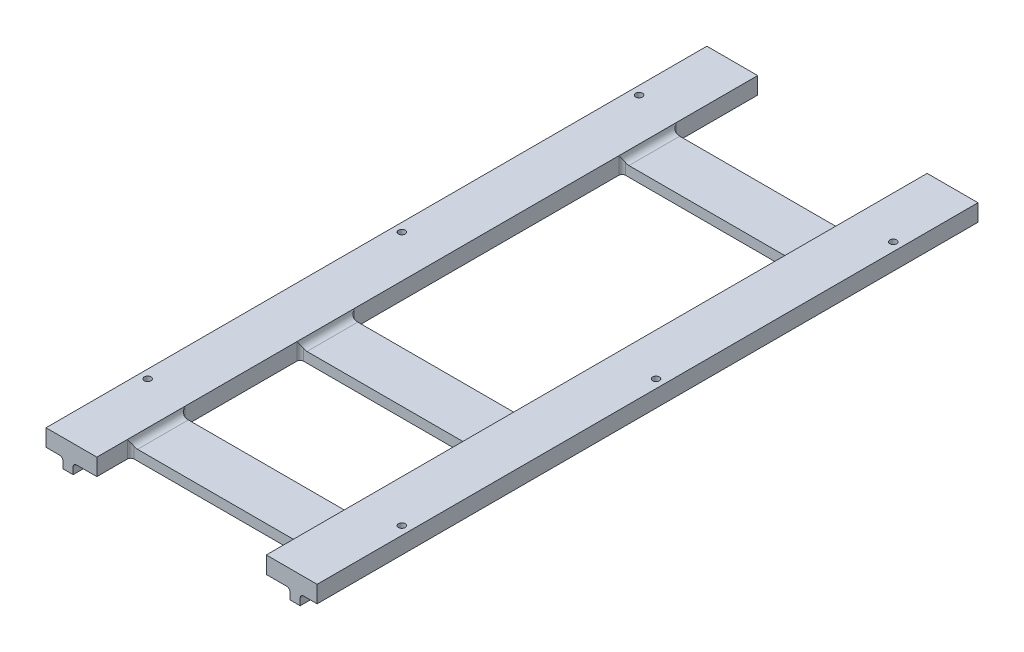
from build123d import *

# Parameters (mm, degrees)
BOSS_EXTRUDE1_DEPTH     = 190
SKETCH2_W               = 50
SKETCH2_H               = 20
CUT_EXTRUDE1_DEPTH      = 50
SKETCH3_W               = 50
SKETCH3_H               = 80
CUT_EXTRUDE2_DEPTH      = 50
SKETCH4_W               = 50
SKETCH4_H               = 35
CUT_EXTRUDE4_DEPTH      = 50
SKETCH9_W               = 15
SKETCH9_H               = 5
BOSS_EXTRUDE4_DEPTH     = 5
SKETCH5_R               = 1
CUT_EXTRUDE5_DEPTH      = 10
CUT_EXTRUDE6_DEPTH      = 100
CUT_EXTRUDE6_DEPTH_BACK = 10
SKETCH6_R               = 1
FILLET1_R               = 1
FILLET2_R               = 2


with BuildPart() as part:
    # Sketch1 → Boss-Extrude1 (new body)
    with BuildSketch(Plane.XY):
        Polygon((-5.73630137, 0.530821918), (9.26369863, 0.530821918), (9.26369863, -1.469178082), (59.26369863, -1.469178082), (59.26369863, 0.530821918), (74.26369863, 0.530821918), (74.26369863, -4.469178082), (69.26369863, -4.469178082), (69.26369863, -7.469178082), (66.26369863, -7.469178082), (66.26369863, -4.469178082), (2.26369863, -4.469178082), (2.26369863, -7.469178082), (-0.73630137, -7.469178082), (-0.73630137, -4.469178082), (-5.73630137, -4.469178082), align=None)
    extrude(amount=BOSS_EXTRUDE1_DEPTH)

    # Sketch2 → Cut-Extrude1 (cut)
    with BuildSketch(Plane(origin=(0, -1.469178082, 0), x_dir=(1, 0, 0), z_dir=(0, 1, 0))):
        with Locations((34.26369863, -10)):
            Rectangle(SKETCH2_W, SKETCH2_H)
        with Locations((34.26369863, -190)):
            Rectangle(SKETCH2_W, SKETCH2_H)
    extrude(amount=-CUT_EXTRUDE1_DEPTH, mode=Mode.SUBTRACT)

    # Sketch3 → Cut-Extrude2 (cut)
    with BuildSketch(Plane(origin=(0, -1.469178082, 0), x_dir=(1, 0, 0), z_dir=(0, 1, 0))):
        with Locations((34.26369863, -75)):
            Rectangle(SKETCH3_W, SKETCH3_H)
    extrude(amount=-CUT_EXTRUDE2_DEPTH, mode=Mode.SUBTRACT)

    # Sketch4 → Cut-Extrude4 (cut)
    with BuildSketch(Plane(origin=(0, -1.469178082, 0), x_dir=(1, 0, 0), z_dir=(0, 1, 0))):
        with Locations((34.26369863, -147.5)):
            Rectangle(SKETCH4_W, SKETCH4_H)
    extrude(amount=-CUT_EXTRUDE4_DEPTH, mode=Mode.SUBTRACT)

    # Sketch9 → Boss-Extrude4 (add)
    with BuildSketch(Plane(origin=(0, 0, 0), x_dir=(-1, 0, 0), z_dir=(0, 0, -1))):
        with Locations((-66.76369863, -1.969178082)):
            Rectangle(SKETCH9_W, SKETCH9_H)
        with Locations((-1.76369863, -1.969178082)):
            Rectangle(SKETCH9_W, SKETCH9_H)
    extrude(amount=BOSS_EXTRUDE4_DEPTH)

    # Sketch5 → Cut-Extrude5 (cut)
    with BuildSketch(Plane(origin=(0, -4.469178082, 0), x_dir=(-1, 0, 0), z_dir=(0, -1, 0))):
        with Locations(Location((-71.76369863, -162.5, 0), (0, 0, 90))):
            Circle(SKETCH5_R)
        with Locations(Location((3.23630137, -162.5, 0), (0, 0, 90))):
            Circle(SKETCH5_R)
    extrude(amount=-CUT_EXTRUDE5_DEPTH, mode=Mode.SUBTRACT)

    # Sketch6 → Cut-Extrude6 (cut, two sides: drawn at the far end of the back side and taken through both)
    with BuildSketch(Plane(origin=(0, -4.469178082, 0), x_dir=(-1, 0, 0), z_dir=(0, -1, 0)).offset(-CUT_EXTRUDE6_DEPTH_BACK)):
        with Locations(Location((3.23630137, -87.5, 0), (0, 0, 270))):
            Circle(SKETCH6_R)
        with Locations(Location((3.23630137, -17.5, 0), (0, 0, 270))):
            Circle(SKETCH6_R)
        with Locations(Location((-71.76369863, -17.5, 0), (0, 0, 270))):
            Circle(SKETCH6_R)
        with Locations(Location((-71.76369863, -87.5, 0), (0, 0, 270))):
            Circle(SKETCH6_R)
    extrude(amount=CUT_EXTRUDE6_DEPTH + CUT_EXTRUDE6_DEPTH_BACK, mode=Mode.SUBTRACT)

    # Fillet1
    fillet1_edges = [part.edges().sort_by_distance(p)[0] for p in [
        (9.26369863, -2.969178082, 165),
        (59.26369863, -2.969178082, 130),
        (9.26369863, -2.969178082, 130),
        (59.26369863, -2.969178082, 165),
        (69.26369863, -4.469178082, 95),
        (66.26369863, -4.469178082, 95),
        (2.26369863, -4.469178082, 95),
        (-0.73630137, -4.469178082, 95),
        (59.26369863, -2.969178082, 20),
        (9.26369863, -2.969178082, 20),
        (9.26369863, -2.969178082, 180),
        (59.26369863, -2.969178082, 180),
        (9.26369863, -2.969178082, 115),
        (59.26369863, -2.969178082, 35),
        (9.26369863, -2.969178082, 35),
        (59.26369863, -2.969178082, 115),
    ]]
    fillet(fillet1_edges, radius=FILLET1_R)

    # Fillet2
    fillet2_edges = [part.edges().sort_by_distance(p)[0] for p in [
        (59.26369863, -1.469178082, 27.5),
        (9.26369863, -1.469178082, 27.5),
        (9.26369863, -1.469178082, 172.5),
        (59.26369863, -1.469178082, 172.5),
        (59.26369863, -1.469178082, 122.5),
        (9.26369863, -1.469178082, 122.5),
    ]]
    fillet(fillet2_edges, radius=FILLET2_R - 0.0001)  # a hair under: the kernel refuses the full size


solid = part.part
